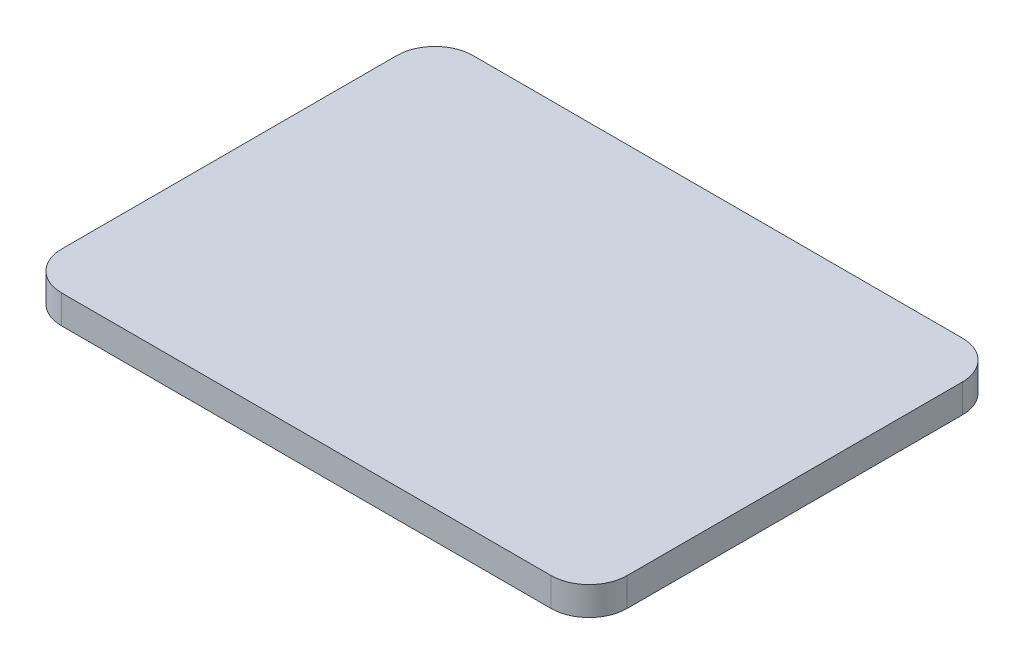
from build123d import *

# Parameters (mm, degrees)
EXTRUDE_1_DEPTH = 15


with BuildPart() as part:
    # Эскиз1 → Бобышка-Вытянуть1 (new body)
    with BuildSketch(Plane(origin=(0, 0, 0), x_dir=(1, 0, 0), z_dir=(0, 1, 0))):
        with BuildLine():
            Line((-128.5, 108), (128.5, 108))
            ThreePointArc((128.5, 108), (142.642135624, 102.142135624), (148.5, 88))
            Line((148.5, 88), (148.5, -88))
            ThreePointArc((148.5, -88), (142.642135624, -102.142135624), (128.5, -108))
            Line((128.5, -108), (-128.5, -108))
            ThreePointArc((-128.5, -108), (-142.642135624, -102.142135624), (-148.5, -88))
            Line((-148.5, -88), (-148.5, 88))
            ThreePointArc((-148.5, 88), (-142.642135624, 102.142135624), (-128.5, 108))
        make_face()
    extrude(amount=EXTRUDE_1_DEPTH)


solid = part.part
